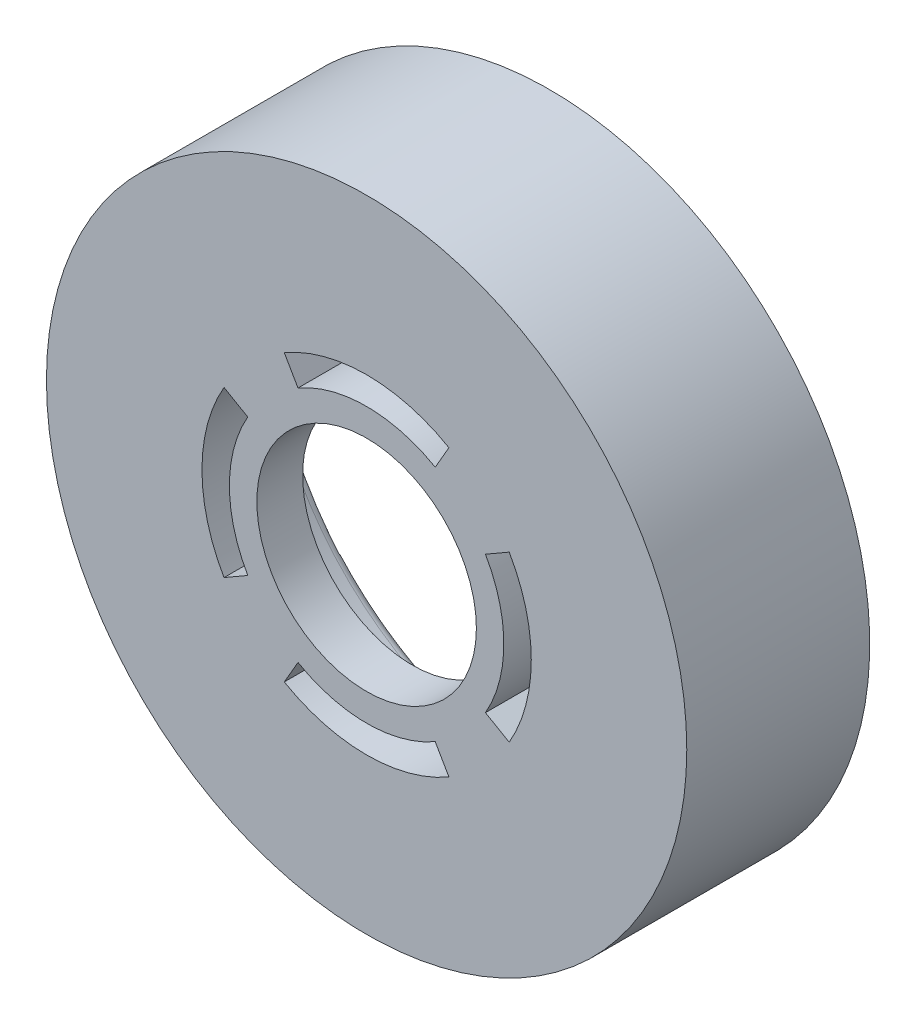
from build123d import *

# Parameters (mm, degrees)
SKETCH_2_R          = 35
SKETCH_2_R_2        = 12
EXTRUDE_1_DEPTH     = 5
EXTRUDE_START       = 15
SKETCH_3_R          = 35
SKETCH_3_R_2        = 30.05
EXTRUDE_2_DEPTH     = 15
SKETCH_4_R          = 1.55
CUT_EXTRUDE_1_DEPTH = 10
FILLET_1_R          = 1
CUT_EXTRUDE_2_DEPTH = 52.720402193


with BuildPart() as part:
    # 草图2 → 凸台-拉伸1 (new body)
    with BuildSketch(Plane.XY):
        Circle(SKETCH_2_R)
        Circle(SKETCH_2_R_2, mode=Mode.SUBTRACT)
    extrude(amount=EXTRUDE_1_DEPTH)

    # 草图3 → 凸台-拉伸2 (add)
    with BuildSketch(Plane(origin=(0, 0, 0), x_dir=(-1, 0, 0), z_dir=(0, 0, -1)).offset(EXTRUDE_START)):
        Circle(SKETCH_3_R)
        Circle(SKETCH_3_R_2, mode=Mode.SUBTRACT)
    extrude(amount=-EXTRUDE_2_DEPTH)

    # 草图4 → 切除-拉伸1 (cut)
    with BuildSketch(Plane(origin=(0, 0, -15), x_dir=(-1, 0, 0), z_dir=(0, 0, -1))):
        with Locations((0, 32.5)):
            Circle(SKETCH_4_R)
        with Locations((32.5, 0)):
            Circle(SKETCH_4_R)
        with Locations((0, -32.5)):
            Circle(SKETCH_4_R)
        with Locations((-32.5, 0)):
            Circle(SKETCH_4_R)
    extrude(amount=-CUT_EXTRUDE_1_DEPTH, mode=Mode.SUBTRACT)

    # 圆角1
    # the kernel refuses this fillet: 1 mm, written as the material it takes off along each edge
    with BuildSketch(Plane(origin=(0, 0, -15), x_dir=(-1, 0, 0), z_dir=(0, -1, 0))) as fillet_1_piece_1:
        with BuildLine():
            CenterArc((30.05 + FILLET_1_R, -FILLET_1_R), FILLET_1_R, 90, 90)
            Line((30.05, -FILLET_1_R), (30.05, 0))
            Line((30.05, 0), (30.05 + FILLET_1_R, 0))
        make_face()
    revolve(axis=Axis((0, 0, -15), (0, 0, -1)), mode=Mode.SUBTRACT)

    # 草图5 → 切除-拉伸2 (cut, through all)
    with BuildSketch(Plane(origin=(0, 0, 0), x_dir=(-1, 0, 0), z_dir=(0, 0, -1))):
        with BuildLine():
            Line((12.990381057, -7.5), (15.588457268, -9))
            ThreePointArc((15.588457268, -9), (18, 0), (15.588457268, 9))
            Line((15.588457268, 9), (12.990381057, 7.5))
            ThreePointArc((12.990381057, 7.5), (15, 0), (12.990381057, -7.5))
        make_face()
        with BuildLine():
            Line((-7.5, 12.990381057), (-9, 15.588457268))
            ThreePointArc((-9, 15.588457268), (0, 18), (9, 15.588457268))
            Line((9, 15.588457268), (7.5, 12.990381057))
            ThreePointArc((7.5, 12.990381057), (0, 15), (-7.5, 12.990381057))
        make_face()
        with BuildLine():
            Line((-7.5, -12.990381057), (-9, -15.588457268))
            ThreePointArc((-9, -15.588457268), (0, -18), (9, -15.588457268))
            Line((9, -15.588457268), (7.5, -12.990381057))
            ThreePointArc((7.5, -12.990381057), (0, -15), (-7.5, -12.990381057))
        make_face()
        with BuildLine():
            Line((-12.990381057, 7.5), (-15.588457268, 9))
            ThreePointArc((-15.588457268, 9), (-18, 0), (-15.588457268, -9))
            Line((-15.588457268, -9), (-12.990381057, -7.5))
            ThreePointArc((-12.990381057, -7.5), (-15, 0), (-12.990381057, 7.5))
        make_face()
    extrude(amount=-CUT_EXTRUDE_2_DEPTH, mode=Mode.SUBTRACT)


solid = part.part
